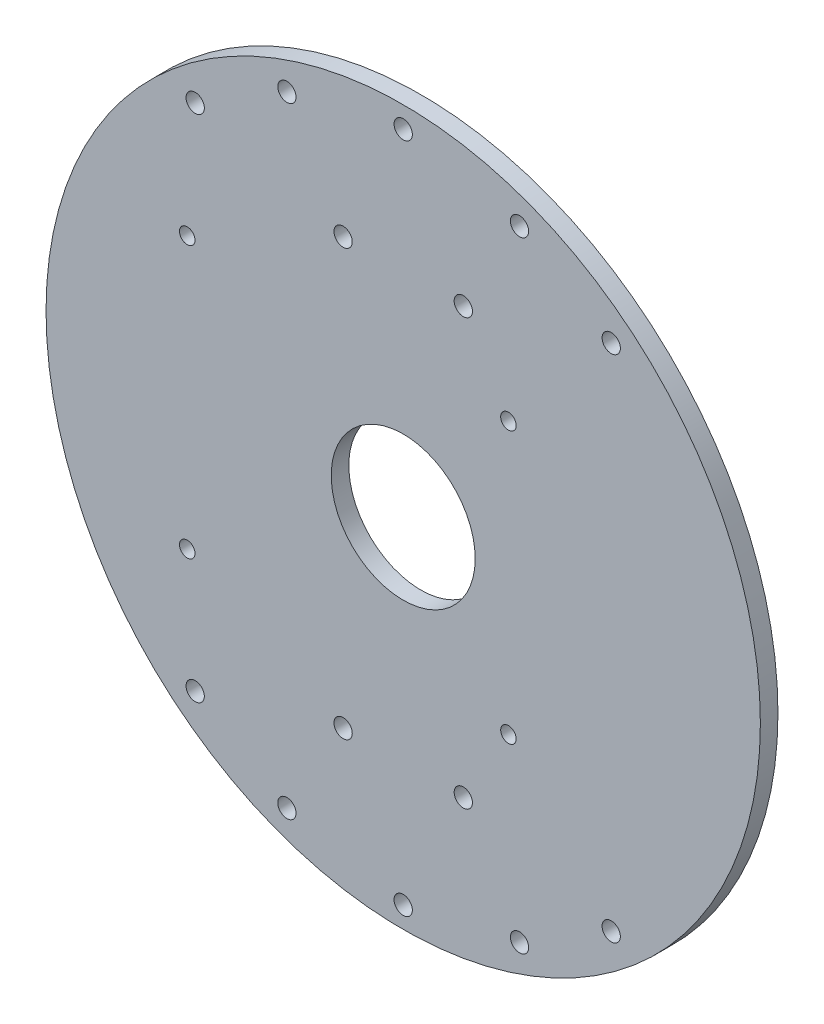
from build123d import *

# Parameters (mm, degrees)
SKETCH1_R           = 64.5
SKETCH1_R_2         = 1.65
SKETCH1_R_3         = 13
SKETCH1_R_4         = 1.4
BOSS_EXTRUDE2_DEPTH = 3.175


with BuildPart() as part:
    # Sketch1 → Boss-Extrude2 (new body)
    with BuildSketch(Plane(origin=(0, 0, 0), x_dir=(-1, 0, 0), z_dir=(0, 0, 1))):
        with Locations((15.168596538, 0.366425758)):
            Circle(SKETCH1_R)
        with Locations((15.168596538, -60.283574242)):
            Circle(SKETCH1_R_2, mode=Mode.SUBTRACT)
        with Locations((15.168596538, 61.016425758)):
            Circle(SKETCH1_R_2, mode=Mode.SUBTRACT)
        with Locations((26.018596538, -38.058574242)):
            Circle(SKETCH1_R_2, mode=Mode.SUBTRACT)
        with Locations((4.318596538, -38.058574242)):
            Circle(SKETCH1_R_2, mode=Mode.SUBTRACT)
        with Locations((26.018596538, 38.791425758)):
            Circle(SKETCH1_R_2, mode=Mode.SUBTRACT)
        with Locations((4.318596538, 38.791425758)):
            Circle(SKETCH1_R_2, mode=Mode.SUBTRACT)
        with Locations((15.168596538, 0.366425758)):
            Circle(SKETCH1_R_3, mode=Mode.SUBTRACT)
        with Locations((54.168596538, -24.133574242)):
            Circle(SKETCH1_R_4, mode=Mode.SUBTRACT)
        with Locations((54.168596538, 24.866425758)):
            Circle(SKETCH1_R_4, mode=Mode.SUBTRACT)
        with Locations((-3.831403462, -24.133574242)):
            Circle(SKETCH1_R_4, mode=Mode.SUBTRACT)
        with Locations((-3.831403462, 24.866425758)):
            Circle(SKETCH1_R_4, mode=Mode.SUBTRACT)
        with Locations((-5.831403462, 56.366425758)):
            Circle(SKETCH1_R_2, mode=Mode.SUBTRACT)
        with Locations((-22.394874657, 46.366425758)):
            Circle(SKETCH1_R_2, mode=Mode.SUBTRACT)
        with Locations((36.168596538, 56.366425758)):
            Circle(SKETCH1_R_2, mode=Mode.SUBTRACT)
        with Locations((52.732067734, 46.366425758)):
            Circle(SKETCH1_R_2, mode=Mode.SUBTRACT)
        with Locations((52.732067734, -45.633574242)):
            Circle(SKETCH1_R_2, mode=Mode.SUBTRACT)
        with Locations((36.168596538, -55.633574242)):
            Circle(SKETCH1_R_2, mode=Mode.SUBTRACT)
        with Locations((-5.831403462, -55.633574242)):
            Circle(SKETCH1_R_2, mode=Mode.SUBTRACT)
        with Locations((-22.394874657, -45.633574242)):
            Circle(SKETCH1_R_2, mode=Mode.SUBTRACT)
    extrude(amount=BOSS_EXTRUDE2_DEPTH)


solid = part.part
